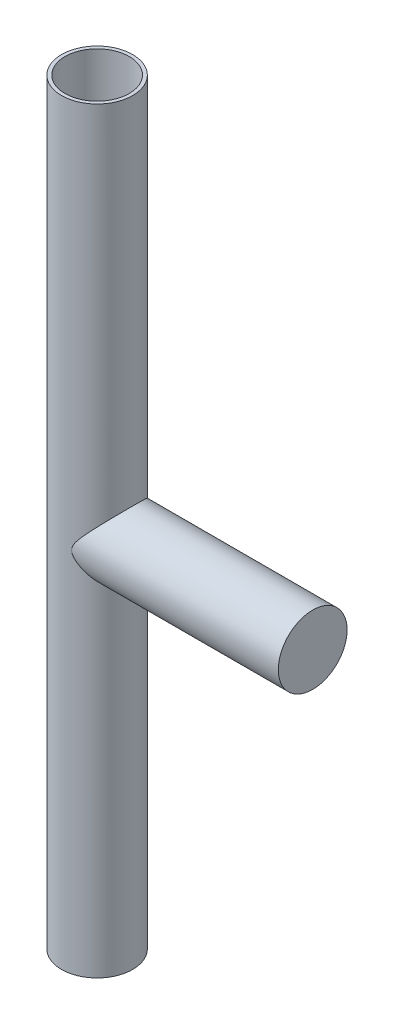
from build123d import *

# Parameters (mm, degrees)
BOSS_EXTRUDE1_DEPTH      = 160
BOSS_EXTRUDE1_DEPTH_BACK = 5
SKETCH1_R                = 7.75
SKETCH1_R_2              = 7
SKETCH5_R                = 7.5
BOSS_EXTRUDE3_DEPTH      = 47


with BuildPart() as part:
    # Sketch1 → Boss-Extrude1 (new, two sides: drawn at the far end of the back side and taken through both)
    with BuildSketch(Plane(origin=(0, 0, 0), x_dir=(1, 0, 0), z_dir=(0, 1, 0)).offset(-BOSS_EXTRUDE1_DEPTH_BACK)):
        Circle(SKETCH1_R)
        Circle(SKETCH1_R_2, mode=Mode.SUBTRACT)
    extrude(amount=BOSS_EXTRUDE1_DEPTH + BOSS_EXTRUDE1_DEPTH_BACK)

    # Sketch5 → Boss-Extrude3 (add)
    with BuildSketch(Plane(origin=(0, 0, 0), x_dir=(0, 0, -1), z_dir=(1, 0, 0))):
        with Locations((0, 75)):
            Circle(SKETCH5_R)
    extrude(amount=BOSS_EXTRUDE3_DEPTH)


solid = part.part
